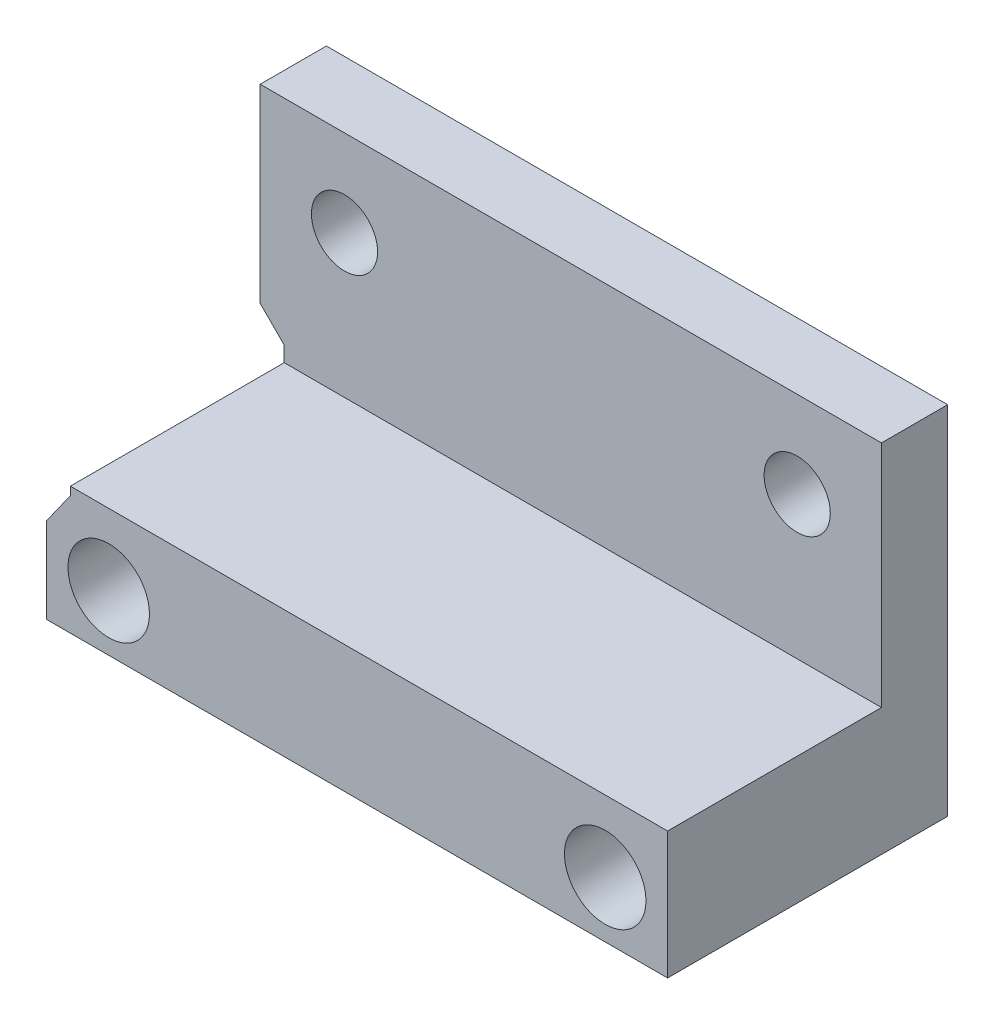
from build123d import *

# Parameters (mm, degrees)
SKETCH1_W           = 24.4
SKETCH1_H           = 14
SKETCH1_R           = 1.3
BOSS_EXTRUDE1_DEPTH = 2.6
SKETCH2_W           = 24.4
SKETCH2_H           = 5
BOSS_EXTRUDE2_DEPTH = 11
SKETCH3_R           = 1.6
CUT_EXTRUDE1_DEPTH  = 4.6
CUT_EXTRUDE2_DEPTH  = 22.583326898


with BuildPart() as part:
    # Sketch1 → Boss-Extrude1 (new body)
    with BuildSketch(Plane.XY):
        with Locations((0, 7)):
            Rectangle(SKETCH1_W, SKETCH1_H)
        with Locations((-8.89, 10.6)):
            Circle(SKETCH1_R, mode=Mode.SUBTRACT)
        with Locations((8.89, 10.6)):
            Circle(SKETCH1_R, mode=Mode.SUBTRACT)
    extrude(amount=BOSS_EXTRUDE1_DEPTH)

    # Sketch2 → Boss-Extrude2 (add)
    with BuildSketch(Plane.XY):
        with Locations((0, 2.5)):
            Rectangle(SKETCH2_W, SKETCH2_H)
    extrude(amount=BOSS_EXTRUDE2_DEPTH)

    # Sketch3 → Cut-Extrude1 (cut)
    with BuildSketch(Plane.XY.offset(11)):
        with Locations((-9.75, 2.2)):
            Circle(SKETCH3_R)
        with Locations((9.75, 2.2)):
            Circle(SKETCH3_R)
    extrude(amount=-CUT_EXTRUDE1_DEPTH, mode=Mode.SUBTRACT)

    # Sketch4 → Cut-Extrude2 (cut, through all)
    with BuildSketch(Plane.XY.offset(11)):
        Polygon((-12.2, 3.343617025), (-11.256951452, 4.675607315), (-11.256951452, 5.600600572), (-12.2, 6.54364912), align=None)
    extrude(amount=-CUT_EXTRUDE2_DEPTH, mode=Mode.SUBTRACT)


solid = part.part
